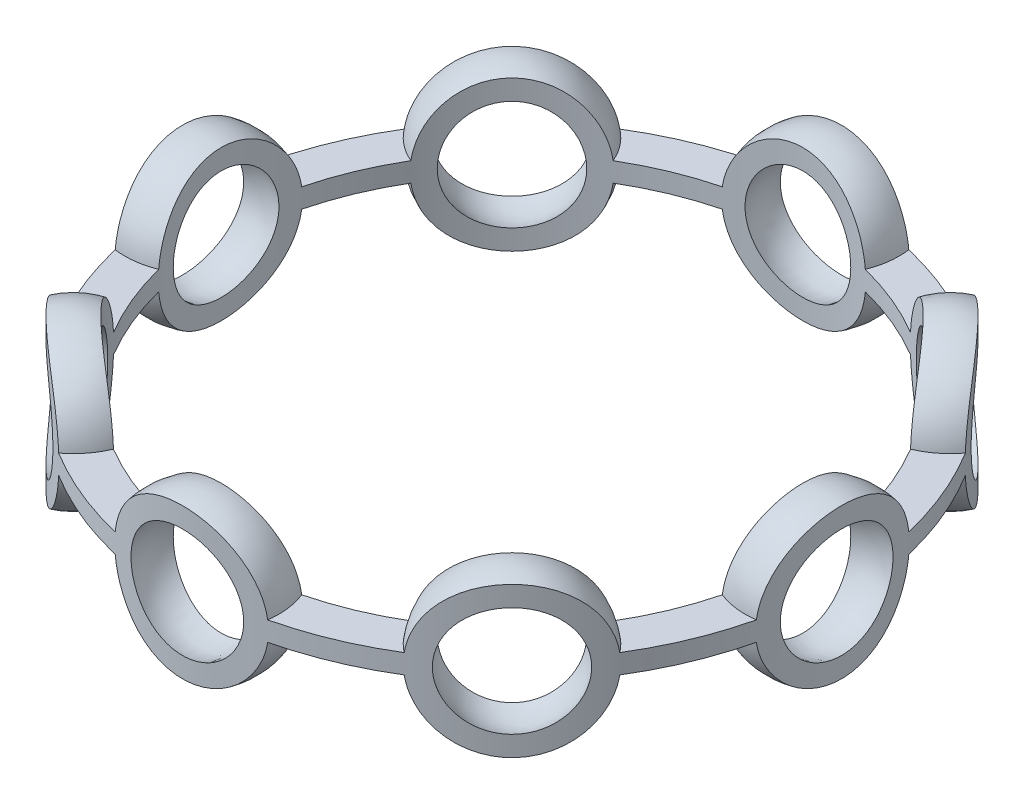
from build123d import *
from build123d.topology import SkipClean

# Parameters (mm, degrees)
SKETCH3_W               = 2
SKETCH3_H               = 1
CIRPATTERN1_COUNT       = 8
CUT_EXTRUDE3_DEPTH      = 29.565713714
CUT_EXTRUDE3_DEPTH_BACK = 29.565713714
SKETCH6_R               = 20
SKETCH6_R_2             = 17
SKETCH6_R_3             = 15
SKETCH6_R_4             = 12


with BuildPart() as part:
    # Sketch3 → Revolve1 (revolve)
    with BuildSketch(Plane.XY):
        with Locations((-16, 0)):
            Rectangle(SKETCH3_W, SKETCH3_H)
    revolve(axis=Axis((0, 0, 0), (0, 1, 0)))

    # Sketch4 → Revolve2 (revolve)
    with BuildSketch(Plane(origin=(0, 0, 0), x_dir=(1, 0, 0), z_dir=(0, 1, 0))):
        with BuildLine():
            Line((-16, 3), (-16, 4))
            ThreePointArc((-16, 4), (-20, 0), (-16, -4))
            Line((-16, -4), (-16, -3))
            ThreePointArc((-16, -3), (-19, 0), (-16, 3))
        make_face()
    revolve2 = revolve(axis=Axis((-16, 0, -4), (0, 0, 1)))

    # Sketch4<5> → Cut-Revolve1 (revolve, cut)
    with BuildSketch(Plane(origin=(0, 0, 0), x_dir=(1, 0, 0), z_dir=(0, 1, 0))):
        with BuildLine():
            Line((-16, -3), (-16, 3))
            ThreePointArc((-16, 3), (-19, 0), (-16, -3))
        make_face()
    cut_revolve1 = revolve(axis=Axis((-16, 0, -4), (0, 0, 1)), mode=Mode.SUBTRACT)

    # CirPattern1: Revolve2, Cut-Revolve1 ×8 about axis
    cirpattern1_axis = Axis((0, 0.5, 0), (0, -1, 0))
    add([revolve2.rotate(cirpattern1_axis, i * 360 / CIRPATTERN1_COUNT) for i in range(1, CIRPATTERN1_COUNT)])
    add([cut_revolve1.rotate(cirpattern1_axis, i * 360 / CIRPATTERN1_COUNT) for i in range(1, CIRPATTERN1_COUNT)], mode=Mode.SUBTRACT)

    # Sketch6 → Cut-Extrude3 (cut, two sides: drawn at the far end of the back side and taken through both)
    # profile 1 of 2: a face of its own
    with SkipClean():  # the faces are left unmerged after this step: merging them gives an invalid solid
        with BuildSketch(Plane(origin=(0, 0, 0), x_dir=(1, 0, 0), z_dir=(0, 1, 0)).offset(-CUT_EXTRUDE3_DEPTH_BACK)):
            Circle(SKETCH6_R)
            Circle(SKETCH6_R_2, mode=Mode.SUBTRACT)
        # profile 2 of 2: a face of its own
        with BuildSketch(Plane(origin=(0, 0, 0), x_dir=(1, 0, 0), z_dir=(0, 1, 0)).offset(-CUT_EXTRUDE3_DEPTH_BACK)):
            Circle(SKETCH6_R_3)
            Circle(SKETCH6_R_4, mode=Mode.SUBTRACT)
        extrude(amount=CUT_EXTRUDE3_DEPTH + CUT_EXTRUDE3_DEPTH_BACK, mode=Mode.SUBTRACT)


solid = part.part
